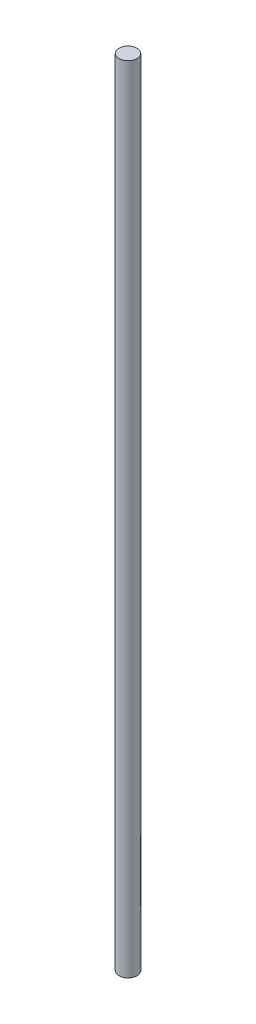
from build123d import *

# Parameters (mm, degrees)
SKETCH1_R           = 3.175
BOSS_EXTRUDE1_DEPTH = 139.7


with BuildPart() as part:
    # Sketch1 → Boss-Extrude1 (new, symmetric)
    with BuildSketch(Plane(origin=(0, 0, 0), x_dir=(1, 0, 0), z_dir=(0, 1, 0))):
        Circle(SKETCH1_R)
    extrude(amount=BOSS_EXTRUDE1_DEPTH, both=True)


solid = part.part
